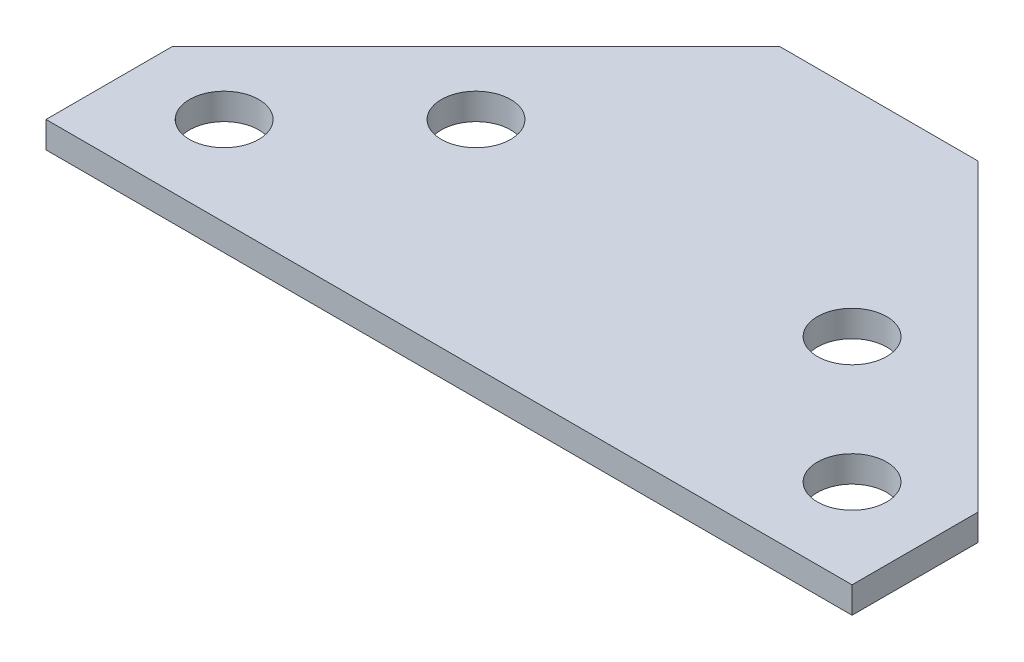
from build123d import *

# Parameters (mm, degrees)
SKETCH_1_R             = 5.25
SM_BASE_FLANGE_1_DEPTH = 4


# Sheet-metal steps are written as plain solids
with BuildPart() as part:
    # Sketch 1 → Базовая кромка1 (new body)
    with BuildSketch(Plane(origin=(0, 0, 0), x_dir=(1, 0, 0), z_dir=(0, 1, 0))):
        Polygon((-61.091883092, 0), (61.091883092, 0), (61.091883092, 19.091883092), (15, 65.183766184), (-15, 65.183766184), (-61.091883092, 19.091883092), align=None)
        with Locations(Location((-28.5, 32.591883092, 0), (0, 0, 270))):
            Circle(SKETCH_1_R, mode=Mode.SUBTRACT)
        with Locations(Location((-47.591883092, 13.5, 0), (0, 0, 270))):
            Circle(SKETCH_1_R, mode=Mode.SUBTRACT)
        with Locations(Location((47.591883092, 13.5, 0), (0, 0, 90))):
            Circle(SKETCH_1_R, mode=Mode.SUBTRACT)
        with Locations(Location((28.5, 32.591883092, 0), (0, 0, 90))):
            Circle(SKETCH_1_R, mode=Mode.SUBTRACT)
    extrude(amount=-SM_BASE_FLANGE_1_DEPTH)


solid = part.part
